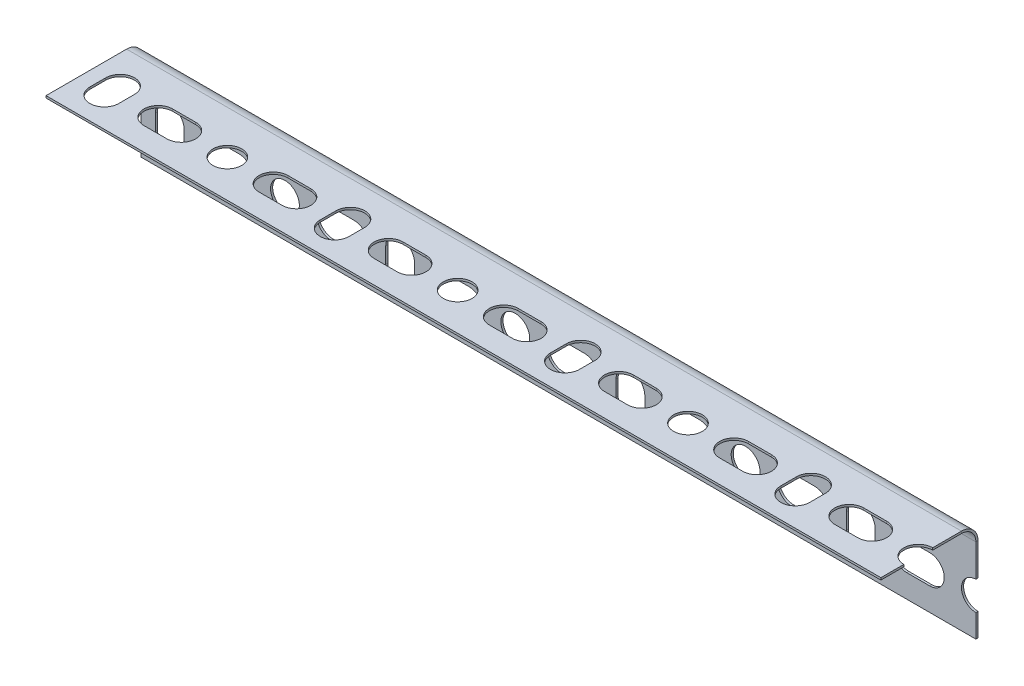
from build123d import *

# Parameters (mm, degrees)
SKETCH1_W                    = 290
SKETCH1_H                    = 0.7366
BASE_FLANGE1_DEPTH           = 35
EDGE_FLANGE1_STRIP_W         = 12.9464
EDGE_FLANGE1_STRIP_H         = 0.7366
EDGE_FLANGE1_STRIP_CUT_DEPTH = 290
EDGE_FLANGE1_DEPTH           = 290
SKETCH11_R                   = 5
CUT_EXTRUDE1_DEPTH           = 153.931874309
LPATTERN1_COUNT              = 14
LPATTERN1_PITCH              = 80
SKETCH12_R                   = 5
CUT_EXTRUDE2_DEPTH           = 35
LPATTERN2_COUNT              = 15
LPATTERN2_PITCH              = 80


# Sheet-metal steps are written as plain solids
with BuildPart() as part:
    # Sketch1 → Base-Flange1 (new body)
    with BuildSketch(Plane(origin=(0, 0, 0), x_dir=(1, 0, 0), z_dir=(0, 1, 0))):
        with Locations((0, -0.3683)):
            Rectangle(SKETCH1_W, SKETCH1_H)
    extrude(amount=BASE_FLANGE1_DEPTH)

    # Edge-Flange1 strip (across the edge) → Edge-Flange1 strip cut (cut)
    with BuildSketch(Plane(origin=(145, 35, 0.7366), x_dir=(0, -1, 0), z_dir=(-1, 0, 0))):
        with Locations((-0.7366, -0.3683)):
            Rectangle(EDGE_FLANGE1_STRIP_W, EDGE_FLANGE1_STRIP_H)
    extrude(amount=EDGE_FLANGE1_STRIP_CUT_DEPTH, mode=Mode.SUBTRACT)

    # Edge-Flange1 section (across the edge) → Edge-Flange1 (add)
    with BuildSketch(Plane(origin=(145, 35, 0.7366), x_dir=(0, -1, 0), z_dir=(-1, 0, 0))):
        with BuildLine():
            Line((0, 5), (0, 33))
            Line((0, 33), (0.7366, 33))
            Line((0.7366, 33), (0.7366, 5))
            ThreePointArc((0.7366, 5), (2.201066094, 1.464466094), (5.7366, 0))
            Line((5.7366, 0), (5.7366, -0.7366))
            ThreePointArc((5.7366, -0.7366), (1.680211239, 0.943611239), (0, 5))
        make_face()
    extrude(amount=EDGE_FLANGE1_DEPTH)

    # Sketch11 → Cut-Extrude1 (cut, through all)
    with BuildSketch(Plane(origin=(0, 35, 0), x_dir=(1, 0, 0), z_dir=(0, 1, 0))):
        with Locations((145, -20.7366)):
            Circle(SKETCH11_R)
        with BuildLine():
            Line((129, -25.7366), (121, -25.7366))
            ThreePointArc((121, -25.7366), (116, -20.7366), (121, -15.7366))
            Line((121, -15.7366), (129, -15.7366))
            ThreePointArc((129, -15.7366), (134, -20.7366), (129, -25.7366))
        make_face()
        with BuildLine():
            Line((89, -25.7366), (81, -25.7366))
            ThreePointArc((81, -25.7366), (76, -20.7366), (81, -15.7366))
            Line((81, -15.7366), (89, -15.7366))
            ThreePointArc((89, -15.7366), (94, -20.7366), (89, -25.7366))
        make_face()
        with BuildLine():
            Line((100, -23.4866), (100, -17.9866))
            ThreePointArc((100, -17.9866), (105, -12.9866), (110, -17.9866))
            Line((110, -17.9866), (110, -23.4866))
            ThreePointArc((110, -23.4866), (105, -28.4866), (100, -23.4866))
        make_face()
    cut_extrude1 = extrude(amount=-CUT_EXTRUDE1_DEPTH, mode=Mode.SUBTRACT)

    # LPattern1: Cut-Extrude1 ×14
    with Locations(*[(-i * LPATTERN1_PITCH, 0, 0) for i in range(1, LPATTERN1_COUNT)]):
        add(cut_extrude1, mode=Mode.SUBTRACT)

    # Sketch12 → Cut-Extrude2 (cut)
    with BuildSketch(Plane.XY.offset(0.7366)):
        with Locations((145, 13)):
            Circle(SKETCH12_R)
        with BuildLine():
            Line((129, 8), (121, 8))
            ThreePointArc((121, 8), (116, 13), (121, 18))
            Line((121, 18), (129, 18))
            ThreePointArc((129, 18), (134, 13), (129, 8))
        make_face()
        with BuildLine():
            Line((100, 10.25), (100, 15.75))
            ThreePointArc((100, 15.75), (105, 20.75), (110, 15.75))
            Line((110, 15.75), (110, 10.25))
            ThreePointArc((110, 10.25), (105, 5.25), (100, 10.25))
        make_face()
        with BuildLine():
            Line((89, 8), (81, 8))
            ThreePointArc((81, 8), (76, 13), (81, 18))
            Line((81, 18), (89, 18))
            ThreePointArc((89, 18), (94, 13), (89, 8))
        make_face()
    cut_extrude2 = extrude(amount=-CUT_EXTRUDE2_DEPTH, mode=Mode.SUBTRACT)

    # LPattern2: Cut-Extrude2 ×15
    with Locations(*[(-i * LPATTERN2_PITCH, 0, 0) for i in range(1, LPATTERN2_COUNT)]):
        add(cut_extrude2, mode=Mode.SUBTRACT)


solid = part.part
